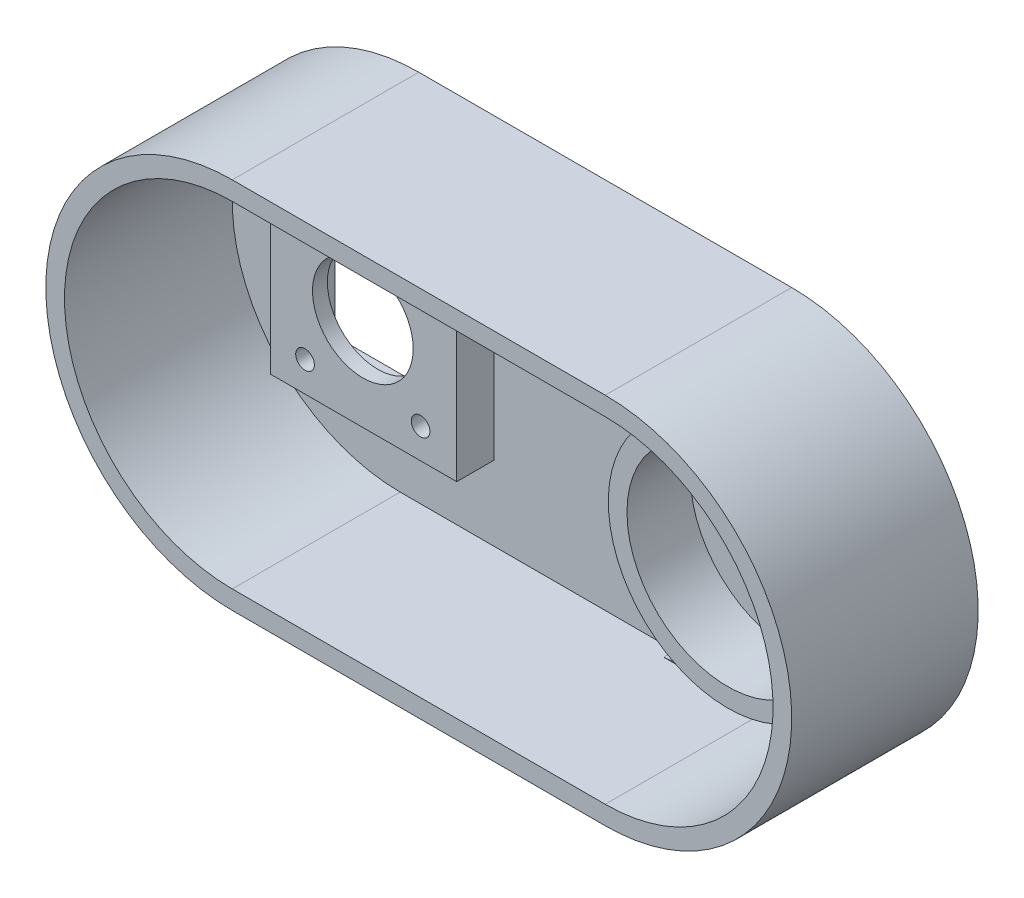
from build123d import *

# Parameters (mm, degrees)
EXTRUDE_THIN1_DEPTH  = 50
BOSS_EXTRUDE1_DEPTH  = 5
SKETCH5_R            = 32
SKETCH5_R_2          = 27
EXTRUDE_THIN4_DEPTH  = 17
SKETCH2_R            = 12.5
CUT_EXTRUDE2_DEPTH   = 126.505472998
BOSS_EXTRUDE4_DEPTH  = 3
FILLET1_R            = 10
FILLET2_R            = 10
BOSS_EXTRUDE5_DEPTH  = 3
FILLET3_R            = 10
FILLET4_R            = 10
BOSS_EXTRUDE11_DEPTH = 3
FILLET6_R            = 10
FILLET7_R            = 10
SKETCH14_W           = 50
SKETCH14_H           = 50
BOSS_EXTRUDE12_DEPTH = 10
CUT_EXTRUDE5_START   = -4
SKETCH16_W           = 45
SKETCH16_H           = 45
SKETCH16_R           = 13.5
SKETCH16_R_2         = 2.5
CUT_EXTRUDE5_DEPTH   = 25
SKETCH16_2_R         = 2.5
SKETCH16_2_R_2       = 13.5
CUT_EXTRUDE6_DEPTH   = 121.318842051


with BuildPart() as part:
    # Sketch1 → Extrude-Thin1 (new body)
    with BuildSketch(Plane.XY):
        with BuildLine():
            Line((-53.6900369, 50), (46.3099631, 50))
            ThreePointArc((46.3099631, 50), (96.3099631, 0), (46.3099631, -50))
            Line((46.3099631, -50), (-53.6900369, -50))
            ThreePointArc((-53.6900369, -50), (-103.6900369, 0), (-53.6900369, 50))
        make_face()
        with BuildLine():
            Line((-53.6900369, 45), (46.3099631, 45))
            ThreePointArc((46.3099631, 45), (91.3099631, 0), (46.3099631, -45))
            Line((46.3099631, -45), (-53.6900369, -45))
            ThreePointArc((-53.6900369, -45), (-98.6900369, 0), (-53.6900369, 45))
        make_face(mode=Mode.SUBTRACT)
    extrude(amount=EXTRUDE_THIN1_DEPTH)

    # Sketch1<3> → Boss-Extrude1 (add)
    with BuildSketch(Plane.XY):
        with BuildLine():
            Line((-53.6900369, -45), (46.3099631, -45))
            ThreePointArc((46.3099631, -45), (91.3099631, 0), (46.3099631, 45))
            Line((46.3099631, 45), (-53.6900369, 45))
            ThreePointArc((-53.6900369, 45), (-98.6900369, 0), (-53.6900369, -45))
        make_face()
    extrude(amount=BOSS_EXTRUDE1_DEPTH)

    # Sketch5 → Extrude-Thin4 (add)
    with BuildSketch(Plane.XY.offset(5)):
        with Locations((51.14065821, -2.257734505)):
            Circle(SKETCH5_R)
        with Locations((51.14065821, -2.257734505)):
            Circle(SKETCH5_R_2, mode=Mode.SUBTRACT)
    extrude(amount=EXTRUDE_THIN4_DEPTH)

    # Sketch2 → Cut-Extrude2 (cut, through all)
    with BuildSketch(Plane(origin=(0, 0, 0), x_dir=(-1, 0, 0), z_dir=(0, 0, -1))):
        with Locations((-51.14065821, -2.257734505)):
            Circle(SKETCH2_R)
    extrude(amount=-CUT_EXTRUDE2_DEPTH, mode=Mode.SUBTRACT)

    # Sketch10 → Boss-Extrude4 (add)
    with BuildSketch(Plane.XY.offset(5)):
        Polygon((51.14065821, 29.742265495), (46.3099631, 45), (33.078782173, 45), (40.95774875, 28.078849927), (41.321043385, 28.19838417), align=None)
    extrude(amount=BOSS_EXTRUDE4_DEPTH)

    # Fillet1
    fillet1_edges = [part.edges().sort_by_distance(p)[0] for p in [
        (40.95774875, 28.078849927, 6.5),
    ]]
    fillet(fillet1_edges, radius=FILLET1_R)

    # Fillet2
    fillet2_edges = [part.edges().sort_by_distance(p)[0] for p in [
        (51.14065821, 29.742265495, 6.5),
    ]]
    fillet(fillet2_edges, radius=FILLET2_R)

    # Sketch11 → Boss-Extrude5 (add)
    with BuildSketch(Plane.XY.offset(5)):
        Polygon((34.756480548, -29.745162946), (25.663670683, -45), (38.486673363, -45), (41.405025332, -32.740802796), align=None)
    extrude(amount=BOSS_EXTRUDE5_DEPTH)

    # Fillet3
    # the kernel refuses this fillet: 10 mm, written as the material it adds along each edge
    with BuildSketch(Plane(origin=(38.486673363, -45, 5), x_dir=(0.9995047638701084, 0.03146787252037754, 0), z_dir=(0, 0, 1))) as fillet3_piece_1:
        with BuildLine():
            CenterArc((13.052927583, 9.940340464), FILLET3_R, 167.167880579, 109.093840461)
            Line((3.302677551, 12.161291679), (2.327652547, 12.3833868))
            ThreePointArc((2.327652547, 12.3833868), (0.686292727, 6.342726217), (-0.965046048, 0.262080378))
            Line((-0.965046048, 0.262080378), (-0.031467873, -0.999504764))
            ThreePointArc((-0.031467873, -0.999504764), (7.787947488, -1.245687048), (14.252700085, -0.994034046))
            Line((14.252700085, -0.994034046), (14.143629858, 0))
        make_face()
    extrude(amount=3)

    # Fillet4
    fillet4_edges = [part.edges().sort_by_distance(p)[0] for p in [
        (25.663670683, -45, 6.5),
    ]]
    fillet(fillet4_edges, radius=FILLET4_R)

    # Sketch13 → Boss-Extrude11 (add)
    with BuildSketch(Plane.XY.offset(5)):
        Polygon((90.705735304, -8.724739526), (82.501490248, -8.724739526), (83.084727444, 0), (91.667524575, 0), align=None)
    extrude(amount=BOSS_EXTRUDE11_DEPTH)

    # Fillet6
    # the kernel refuses this fillet: 10 mm, written as the material it adds along each edge
    with BuildSketch(Plane(origin=(91.3099631, 0, 8), x_dir=(-0.13715489744354328, 0.9905496121382569, 0), z_dir=(0, 0, -1))) as fillet6_piece_1:
        with BuildLine():
            CenterArc((10.972391795, -9.905496121), FILLET6_R, 82.116754313, 87.758074962)
            Line((1.128131353, -8.147503989), (0.931246144, -8.112344146))
            ThreePointArc((0.931246144, -8.112344146), (0.365955754, -4.101182974), (-0.198109922, -0.027430979))
            Line((-0.198109922, -0.027430979), (-0.027430979, 0.198109922))
            ThreePointArc((-0.027430979, 0.198109922), (6.171970385, 0.625267454), (12.371371749, 0.198109922))
            Line((12.371371749, 0.198109922), (12.34394077, 0))
        make_face()
    extrude(amount=3)

    # Fillet7
    # the kernel refuses this fillet: 10 mm, written as the material it adds along each edge
    with BuildSketch(Plane(origin=(90.456071877, -8.724739526, 8), x_dir=(-1, 0, 0), z_dir=(0, 0, -1))) as fillet7_piece_1:
        with BuildLine():
            CenterArc((13.556604147, -8.283558638), FILLET7_R, 124.06978595, 85.005036852)
            Line((4.816745681, -13.1430724), (4.641948512, -13.240262675))
            ThreePointArc((4.641948512, -13.240262675), (1.706415001, -6.828793582), (-0.196204928, -0.03877662))
            Line((-0.196204928, -0.03877662), (0, 0.2))
            ThreePointArc((0, 0.2), (3.977290815, 0.2), (7.842541179, 0.165671173))
            Line((7.842541179, 0.165671173), (7.95458163, 0))
        make_face()
    extrude(amount=3)

    # Sketch14 → Boss-Extrude12 (add)
    with BuildSketch(Plane.XY.offset(5)):
        with Locations((-53.507483995, 0)):
            Rectangle(SKETCH14_W, SKETCH14_H)
    extrude(amount=BOSS_EXTRUDE12_DEPTH)

    # Sketch16 → Cut-Extrude5 (cut)
    with BuildSketch(Plane.XY.offset(15).offset(CUT_EXTRUDE5_START)):
        with Locations((-53.6900369, 0)):
            Rectangle(SKETCH16_W, SKETCH16_H)
        with Locations((-53.6900369, 0)):
            Circle(SKETCH16_R, mode=Mode.SUBTRACT)
        with Locations((-69.1900369, 14.04338148)):
            Circle(SKETCH16_R_2, mode=Mode.SUBTRACT)
        with Locations((-69.1900369, -16.95661852)):
            Circle(SKETCH16_R_2, mode=Mode.SUBTRACT)
        with Locations((-38.1900369, -16.95661852)):
            Circle(SKETCH16_R_2, mode=Mode.SUBTRACT)
        with Locations((-38.1900369, 14.04338148)):
            Circle(SKETCH16_R_2, mode=Mode.SUBTRACT)
    extrude(amount=-CUT_EXTRUDE5_DEPTH, mode=Mode.SUBTRACT)

    # Sketch16<2> → Cut-Extrude6 (cut, through all)
    with BuildSketch(Plane.XY.offset(15)):
        with Locations((-38.1900369, 14.04338148)):
            Circle(SKETCH16_2_R)
        with Locations((-69.1900369, 14.04338148)):
            Circle(SKETCH16_2_R)
        with Locations((-53.6900369, 0)):
            Circle(SKETCH16_2_R_2)
        with Locations((-69.1900369, -16.95661852)):
            Circle(SKETCH16_2_R)
        with Locations(Location((-38.1900369, -16.95661852, 0), (0, 0, 180))):
            Circle(SKETCH16_2_R)
    extrude(amount=-CUT_EXTRUDE6_DEPTH, mode=Mode.SUBTRACT)


solid = part.part
